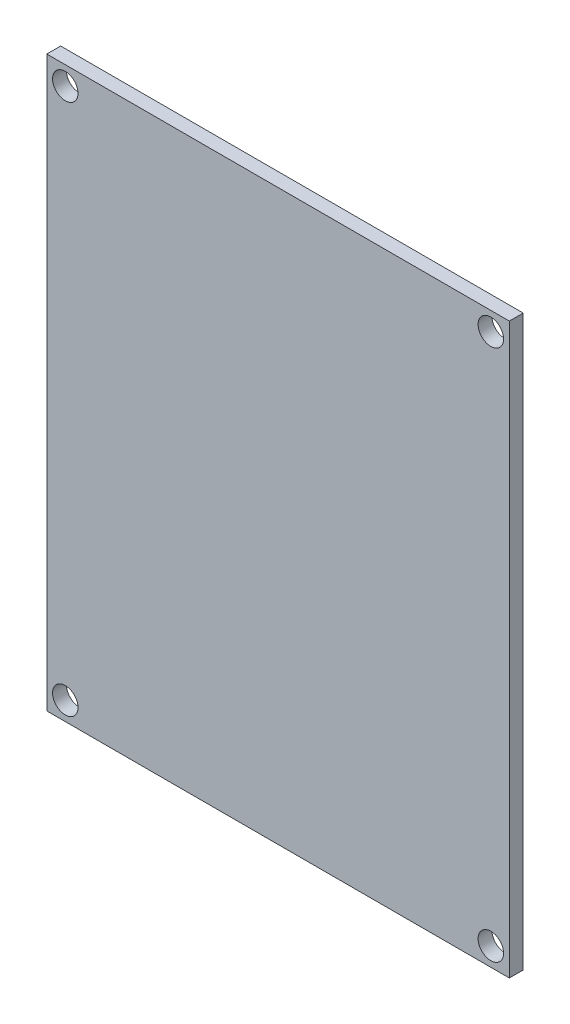
from build123d import *

# Parameters (mm, degrees)
SKETCH2_W           = 80.000081
SKETCH2_H           = 98.399646
SKETCH2_R           = 2.2037585
BOSS_EXTRUDE1_DEPTH = 2.4


with BuildPart() as part:
    # Sketch2 → Boss-Extrude1 (new body)
    with BuildSketch(Plane.XY):
        with Locations((44.1672285, 81.380873)):
            Rectangle(SKETCH2_W, SKETCH2_H)
        with Locations((7.3675435, 127.3803385)):
            Circle(SKETCH2_R, mode=Mode.SUBTRACT)
        with Locations((80.9669095, 127.3803385)):
            Circle(SKETCH2_R, mode=Mode.SUBTRACT)
        with Locations((80.9669095, 35.3814065)):
            Circle(SKETCH2_R, mode=Mode.SUBTRACT)
        with Locations((7.3675435, 35.3814065)):
            Circle(SKETCH2_R, mode=Mode.SUBTRACT)
    extrude(amount=BOSS_EXTRUDE1_DEPTH)


solid = part.part
